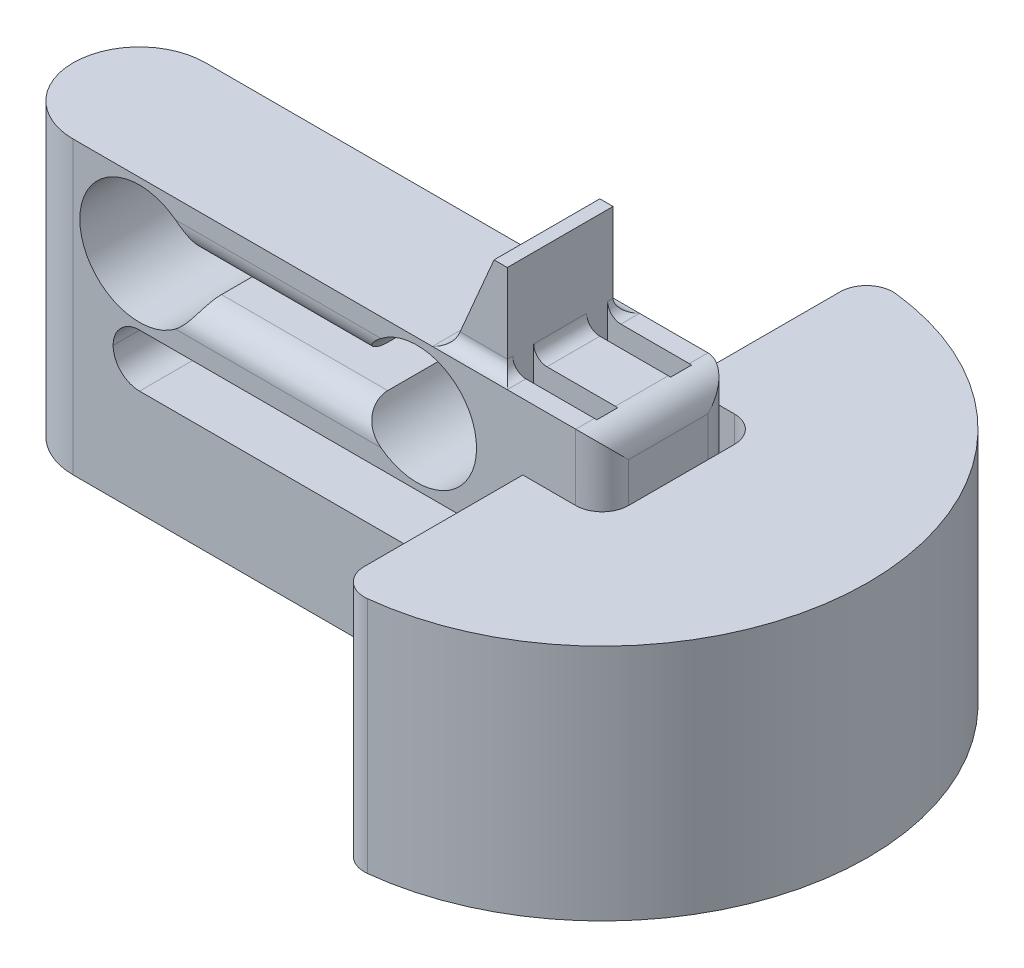
from build123d import *

# Parameters (mm, degrees)
BOSS_EXTRUDE1_DEPTH      = 5
BOSS_EXTRUDE1_DEPTH_BACK = 5
SKETCH2_W                = 6.35
SKETCH2_H                = 1.5875
CUT_EXTRUDE1_DEPTH       = 5
BOSS_EXTRUDE2_START      = -14
SKETCH3_W                = 5.881583951
SKETCH3_H                = 10
BOSS_EXTRUDE2_DEPTH      = 8
BOSS_EXTRUDE3_START      = 10
BOSS_EXTRUDE3_DEPTH      = 10
FILLET2_R                = 5
FILLET6_R                = 2
FILLET3_R                = 2
SKETCH5_R                = 1.5
SKETCH5_W                = 3
SKETCH5_H                = 3
CUT_EXTRUDE2_DEPTH       = 4
FILLET4_R                = 1
SKETCH6_R                = 3.25
CUT_EXTRUDE3_DEPTH       = 5
BOSS_EXTRUDE4_START      = -14
SKETCH7_R                = 2.5
BOSS_EXTRUDE4_DEPTH      = 3.7
SKETCH9_R                = 1.45
CUT_EXTRUDE4_DEPTH       = 4.6
FILLET5_R                = 2.5
SKETCH10_W               = 4
SKETCH10_H               = 8
BOSS_EXTRUDE5_DEPTH      = 7
CUT_EXTRUDE5_REACH       = 53.57
FILLET7_R                = 1


# Some blends are built 0.0001 mm under size
with BuildPart() as part:
    # Sketch1 → Boss-Extrude1 (new, two sides: drawn at the far end of the back side and taken through both)
    with BuildSketch(Plane.XY.offset(-BOSS_EXTRUDE1_DEPTH_BACK)):
        Polygon((5, -10), (5, 0), (0, 0), (-5, 0), (-35, 0), (-40, 0), (-40, -14), (-31.982625312, -14), (-31.982625312, -10), (-5, -10), align=None)
        with BuildLine():
            ThreePointArc((-25.78623506, -6.579298906), (-34.5, -5), (-25.78623506, -3.420701094))
            Line((-25.78623506, -3.420701094), (-13.21376494, -3.420701094))
            ThreePointArc((-13.21376494, -3.420701094), (-8.197485897, -0.572136959), (-4.5, -5))
            ThreePointArc((-4.5, -5), (-8.197485897, -9.427863041), (-13.21376494, -6.579298906))
            Line((-13.21376494, -6.579298906), (-25.78623506, -6.579298906))
        make_face(mode=Mode.SUBTRACT)
    extrude(amount=BOSS_EXTRUDE1_DEPTH + BOSS_EXTRUDE1_DEPTH_BACK)

    # Sketch2 → Cut-Extrude1 (cut)
    with BuildSketch(Plane(origin=(0, 0, 0), x_dir=(1, 0, 0), z_dir=(0, 1, 0))):
        with Locations((0, -2.79375)):
            Rectangle(SKETCH2_W, SKETCH2_H)
        with Locations((0, 2.79375)):
            Rectangle(SKETCH2_W, SKETCH2_H)
    extrude(amount=-CUT_EXTRUDE1_DEPTH, mode=Mode.SUBTRACT)

    # Sketch3 → Boss-Extrude2 (add)
    with BuildSketch(Plane(origin=(0, 0, 0), x_dir=(1, 0, 0), z_dir=(0, 1, 0)).offset(BOSS_EXTRUDE2_START)):
        with BuildLine():
            Line((0, 20.1), (0, 5))
            Line((0, 5), (5.881583951, 5))
            Line((5.881583951, 5), (5.881583951, -5))
            Line((5.881583951, -5), (0, -5))
            Line((0, -5), (0, -20.1))
            ThreePointArc((0, -20.1), (14.212846302, -14.212846302), (20.1, 0))
            ThreePointArc((20.1, 0), (14.212846302, 14.212846302), (0, 20.1))
        make_face()
        with Locations((2.940791976, 0)):
            Rectangle(SKETCH3_W, SKETCH3_H)
        with BuildLine():
            Line((0, 5), (-19.468179165, 5))
            ThreePointArc((-19.468179165, 5), (-20.1, 0), (-19.468179165, -5))
            Line((-19.468179165, -5), (0, -5))
            Line((0, -5), (0, 5))
        make_face()
        with BuildLine():
            Line((-19.468179165, 5), (-40, 5))
            Line((-40, 5), (-40, -5))
            Line((-40, -5), (-19.468179165, -5))
            ThreePointArc((-19.468179165, -5), (-20.1, 0), (-19.468179165, 5))
        make_face()
    extrude(amount=-BOSS_EXTRUDE2_DEPTH)

    # Sketch4 → Boss-Extrude3 (add)
    with BuildSketch(Plane(origin=(0, -14, 0), x_dir=(1, 0, 0), z_dir=(0, 1, 0)).offset(BOSS_EXTRUDE3_START)):
        with BuildLine():
            ThreePointArc((20.1, 0), (14.212846302, 14.212846302), (0, 20.1))
            Line((0, 20.1), (0, 6))
            Line((0, 6), (6, 6))
            Line((6, 6), (6, -6))
            Line((6, -6), (0, -6))
            Line((0, -6), (0, -20.1))
            ThreePointArc((0, -20.1), (14.212846302, -14.212846302), (20.1, 0))
        make_face()
    extrude(amount=-BOSS_EXTRUDE3_DEPTH)

    # Fillet2
    fillet2_edges = [part.edges().sort_by_distance(p)[0] for p in [
        (-40, -11, -5),
        (-40, -11, 5),
    ]]
    fillet(fillet2_edges, radius=FILLET2_R - 0.0001)  # a hair under: the kernel refuses the full size

    # Fillet6
    # the kernel refuses this fillet: 2 mm, written as the material it adds along each edge
    with BuildSketch(Plane(origin=(6, -4, -6), x_dir=(-1, 0, 0), z_dir=(0, -1, 0))) as fillet6_piece_1:
        with BuildLine():
            CenterArc((FILLET6_R, -FILLET6_R), FILLET6_R, 90, 90)
            Line((0, -FILLET6_R), (0, 0))
            Line((0, 0), (FILLET6_R, 0))
        make_face()
    extrude(amount=15)
    with BuildSketch(Plane(origin=(6, -4, 6), x_dir=(-1, 0, 0), z_dir=(0, -1, 0))) as fillet6_piece_2:
        with BuildLine():
            CenterArc((FILLET6_R, FILLET6_R), FILLET6_R, 180, 90)
            Line((0, FILLET6_R), (0, 0))
            Line((0, 0), (FILLET6_R, 0))
        make_face()
    extrude(amount=15)
    # the kernel refuses this fillet: 2 mm, written as the material it takes off along each edge
    with BuildSketch(Plane(origin=(5, -15, -5), x_dir=(0, 0, 1), z_dir=(0, 1, 0))) as fillet6_2_piece_1_section:
        with BuildLine():
            CenterArc((FILLET6_R, -FILLET6_R), FILLET6_R, 90, 90)
            Line((0, -FILLET6_R), (0, 0))
            Line((0, 0), (FILLET6_R, 0))
        make_face()
    fillet6_2_piece_1 = extrude(amount=20, mode=Mode.PRIVATE)
    fillet6_2_piece_1 = split(fillet6_2_piece_1, bisect_by=Plane(origin=(4.553264122, -14, -4.553264122), z_dir=(0, 1, 0)), keep=Keep.TOP, mode=Mode.PRIVATE)
    add(fillet6_2_piece_1, mode=Mode.SUBTRACT)
    with BuildSketch(Plane(origin=(5, -15, 5), x_dir=(-1, 0, 0), z_dir=(0, 1, 0))) as fillet6_2_piece_2_section:
        with BuildLine():
            CenterArc((FILLET6_R, -FILLET6_R), FILLET6_R, 90, 90)
            Line((0, -FILLET6_R), (0, 0))
            Line((0, 0), (FILLET6_R, 0))
        make_face()
    fillet6_2_piece_2 = extrude(amount=20, mode=Mode.PRIVATE)
    fillet6_2_piece_2 = split(fillet6_2_piece_2, bisect_by=Plane(origin=(4.553264122, -14, 4.553264122), z_dir=(0, 1, 0)), keep=Keep.TOP, mode=Mode.PRIVATE)
    add(fillet6_2_piece_2, mode=Mode.SUBTRACT)
    with BuildSketch(Plane(origin=(5, 0, -10), x_dir=(-1, 0, 0), z_dir=(0, 0, 1))) as fillet6_2_piece_3:
        with BuildLine():
            CenterArc((FILLET6_R, FILLET6_R), FILLET6_R, 180, 90)
            Line((0, FILLET6_R), (0, 0))
            Line((0, 0), (FILLET6_R, 0))
        make_face()
    extrude(amount=20, mode=Mode.SUBTRACT)

    # Fillet3
    fillet3_edges = [part.edges().sort_by_distance(p)[0] for p in [
        (-19.5, -3.420701094, -5),
        (-19.5, -6.579298906, -5),
        (-19.5, -6.579298906, 5),
        (-19.5, -3.420701094, 5),
        (-31.982625312, -10, 0),
        (-31.982625312, -14, 0),
        (0, -13, -20.1),
        (0, -13, 20.1),
    ]]
    fillet(fillet3_edges, radius=FILLET3_R - 0.0001)  # a hair under: the kernel refuses the full size

    # Sketch5 → Cut-Extrude2 (cut)
    with BuildSketch(Plane.XZ.offset(22)):
        with Locations(Location((0, 0, 0), (0, 0, 270))):
            Circle(SKETCH5_R)
        with BuildLine():
            Line((-35, 3.25), (-12, 3.25))
            ThreePointArc((-12, 3.25), (-8.75, 0), (-12, -3.25))
            Line((-12, -3.25), (-35, -3.25))
            ThreePointArc((-35, -3.25), (-38.25, 0), (-35, 3.25))
        make_face()
        with Locations((-6, 0)):
            Rectangle(SKETCH5_W, SKETCH5_H)
        with Locations((6, 0)):
            Rectangle(SKETCH5_W, SKETCH5_H)
    extrude(amount=-CUT_EXTRUDE2_DEPTH, mode=Mode.SUBTRACT)

    # Fillet4
    fillet4_edges = [part.edges().sort_by_distance(p)[0] for p in [
        (-23.5, -18, 3.25),
        (-8.75, -18, 0),
        (-23.5, -18, -3.25),
        (-38.25, -18, 0),
        (0, -18, -5),
        (0, -18, 5),
    ]]
    fillet(fillet4_edges, radius=FILLET4_R)

    # Sketch6 → Cut-Extrude3 (cut)
    with BuildSketch(Plane.XZ.offset(22)):
        with Locations(Location((-35, 0, 0), (0, 0, 270))):
            Circle(SKETCH6_R)
    extrude(amount=-CUT_EXTRUDE3_DEPTH, mode=Mode.SUBTRACT)

    # Sketch7 → Boss-Extrude4 (add)
    with BuildSketch(Plane(origin=(0, 0, 0), x_dir=(1, 0, 0), z_dir=(0, 1, 0)).offset(BOSS_EXTRUDE4_START)):
        with Locations(Location((0, 0, 0), (0, 0, 270))):
            Circle(SKETCH7_R)
    extrude(amount=BOSS_EXTRUDE4_DEPTH)

    # Sketch9 → Cut-Extrude4 (cut)
    with BuildSketch(Plane(origin=(0, -10.3, 0), x_dir=(1, 0, 0), z_dir=(0, 1, 0))):
        with Locations(Location((0, 0, 0), (0, 0, 270))):
            Circle(SKETCH9_R)
    extrude(amount=-CUT_EXTRUDE4_DEPTH, mode=Mode.SUBTRACT)

    # Fillet5
    fillet5_edges = [part.edges().sort_by_distance(p)[0] for p in [
        (0, -14, -2.5),
    ]]
    fillet(fillet5_edges, radius=FILLET5_R)

    # Sketch10 → Boss-Extrude5 (add)
    with BuildSketch(Plane(origin=(0, 0, 0), x_dir=(1, 0, 0), z_dir=(0, 1, 0))):
        with Locations((-5.175, 0)):
            Rectangle(SKETCH10_W, SKETCH10_H)
    extrude(amount=BOSS_EXTRUDE5_DEPTH)

    # Sketch11 → Cut-Extrude5 (cut, up to next)
    with BuildSketch(Plane.XY.offset(4), mode=Mode.PRIVATE) as cut_extrude5_sk1:
        Polygon((-7.175, 0), (-7.175, 7), (-4.175, 7), align=None)
    cut_extrude5_tool1 = extrude(cut_extrude5_sk1.sketch, amount=-CUT_EXTRUDE5_REACH, mode=Mode.PRIVATE) & part.part
    add(cut_extrude5_tool1.solids().sort_by_distance((-6.175, 4.666667, 4))[0], mode=Mode.SUBTRACT)

    # Fillet7
    # the kernel refuses this fillet: 1 mm, written as the material it adds along each edge
    with BuildSketch(Plane(origin=(-3.175, 0, 4), x_dir=(1, 0, 0), z_dir=(0, 0, -1)), Plane(origin=(-3.175, 0, -3.5875), x_dir=(1, 0, 0), z_dir=(0, 0, -1))) as fillet7_piece_1:
        with BuildLine():
            CenterArc((FILLET7_R, -FILLET7_R), FILLET7_R, 90, 90)
            Line((0, -FILLET7_R), (0, 0))
            Line((0, 0), (FILLET7_R, 0))
        make_face()
    extrude(amount=0.4125)
    with BuildSketch(Plane(origin=(-3.175, 0, 4), x_dir=(1, 0, 0), z_dir=(0, 0, -1))) as fillet7_piece_2_section:
        with BuildLine():
            CenterArc((FILLET7_R, -FILLET7_R), FILLET7_R, 90, 90)
            Line((0, -FILLET7_R), (0, 0))
            Line((0, 0), (FILLET7_R, 0))
        make_face()
    fillet7_piece_2 = extrude(amount=2.9125, mode=Mode.PRIVATE)
    fillet7_piece_2 = split(fillet7_piece_2, bisect_by=Plane(origin=(-2.948604886, 0.226395114, 2), z_dir=(0, 0, -1)), keep=Keep.TOP, mode=Mode.PRIVATE)
    add(fillet7_piece_2)
    with BuildSketch(Plane(origin=(-3.175, 0, 4.5), x_dir=(0, 1, 0), z_dir=(0, 0, -1))) as fillet7_piece_3_section:
        with BuildLine():
            CenterArc((FILLET7_R, FILLET7_R), FILLET7_R, 180, 90)
            Line((0, FILLET7_R), (0, 0))
            Line((0, 0), (FILLET7_R, 0))
        make_face()
    fillet7_piece_3 = extrude(amount=6.5, mode=Mode.PRIVATE)
    fillet7_piece_3 = split(fillet7_piece_3, bisect_by=Plane(origin=(-2.948604886, 0.226395114, 3.5875), z_dir=(0, 0, 1)), keep=Keep.TOP, mode=Mode.PRIVATE)
    fillet7_piece_3 = split(fillet7_piece_3, bisect_by=Plane(origin=(-2.948604886, 0.226395114, 4), z_dir=(0, 0, -1)), keep=Keep.TOP, mode=Mode.PRIVATE)
    add(fillet7_piece_3)
    with BuildSketch(Plane(origin=(-3.175, 0, 2), x_dir=(0, 1, 0), z_dir=(0, 0, -1))) as fillet7_piece_4:
        with BuildLine():
            CenterArc((FILLET7_R, FILLET7_R), FILLET7_R, 180, 90)
            Line((0, FILLET7_R), (0, 0))
            Line((0, 0), (FILLET7_R, 0))
        make_face()
    extrude(amount=4)
    with BuildSketch(Plane(origin=(-3.175, 0, 2), x_dir=(0, 1, 0), z_dir=(0, 0, -1))) as fillet7_piece_5_section:
        with BuildLine():
            CenterArc((FILLET7_R, FILLET7_R), FILLET7_R, 180, 90)
            Line((0, FILLET7_R), (0, 0))
            Line((0, 0), (FILLET7_R, 0))
        make_face()
    fillet7_piece_5 = extrude(amount=6.5, mode=Mode.PRIVATE)
    fillet7_piece_5 = split(fillet7_piece_5, bisect_by=Plane(origin=(-2.948604886, 0.226395114, -3.5875), z_dir=(0, 0, -1)), keep=Keep.TOP, mode=Mode.PRIVATE)
    fillet7_piece_5 = split(fillet7_piece_5, bisect_by=Plane(origin=(-2.948604886, 0.226395114, -4), z_dir=(0, 0, 1)), keep=Keep.TOP, mode=Mode.PRIVATE)
    add(fillet7_piece_5)
    with BuildSketch(Plane(origin=(-3.175, 0, -1.0875), x_dir=(1, 0, 0), z_dir=(0, 0, -1))) as fillet7_piece_6_section:
        with BuildLine():
            CenterArc((FILLET7_R, -FILLET7_R), FILLET7_R, 90, 90)
            Line((0, -FILLET7_R), (0, 0))
            Line((0, 0), (FILLET7_R, 0))
        make_face()
    fillet7_piece_6 = extrude(amount=2.9125, mode=Mode.PRIVATE)
    fillet7_piece_6 = split(fillet7_piece_6, bisect_by=Plane(origin=(-2.948604886, 0.226395114, -2), z_dir=(0, 0, 1)), keep=Keep.TOP, mode=Mode.PRIVATE)
    add(fillet7_piece_6)
    with BuildSketch(Plane(origin=(-3.175, 0, -4), x_dir=(0, 0, -1), z_dir=(-1, 0, 0))) as fillet7_piece_7_section:
        with BuildLine():
            CenterArc((FILLET7_R, -FILLET7_R), FILLET7_R, 90, 90)
            Line((0, -FILLET7_R), (0, 0))
            Line((0, 0), (FILLET7_R, 0))
        make_face()
    fillet7_piece_7 = extrude(amount=6.5, mode=Mode.PRIVATE)
    fillet7_piece_7 = split(fillet7_piece_7, bisect_by=Plane(origin=(-6.777174101, 0.928260431, -4.229410037), z_dir=(0.9191450300180579, -0.3939192985791677, 0)), keep=Keep.TOP, mode=Mode.PRIVATE)
    add(fillet7_piece_7)
    with BuildSketch(Plane(origin=(-7.175, 0, -4), x_dir=(-1, 0, 0), z_dir=(0, 0, 1))) as fillet7_piece_8:
        with BuildLine():
            CenterArc((FILLET7_R * 0.659396157981, -FILLET7_R), FILLET7_R, 90, 66.801409486)
            Line((-FILLET7_R * 0.259748872037, -FILLET7_R * 0.606080701421), (0, 0))
            Line((0, 0), (FILLET7_R * 0.659396157981, 0))
        make_face()
    extrude(amount=8)
    with BuildSketch(Plane(origin=(-9.675, 0, 4), x_dir=(0, 0, 1), z_dir=(1, 0, 0))) as fillet7_piece_9_section:
        with BuildLine():
            CenterArc((FILLET7_R, -FILLET7_R), FILLET7_R, 90, 90)
            Line((0, -FILLET7_R), (0, 0))
            Line((0, 0), (FILLET7_R, 0))
        make_face()
    fillet7_piece_9 = extrude(amount=6.5, mode=Mode.PRIVATE)
    fillet7_piece_9 = split(fillet7_piece_9, bisect_by=Plane(origin=(-6.777174101, 0.928260431, 4.229410037), z_dir=(0.9191450300180579, -0.3939192985791677, 0)), keep=Keep.TOP, mode=Mode.PRIVATE)
    add(fillet7_piece_9)
    with BuildSketch(Plane(origin=(-3.175, 0, 6.5), x_dir=(1, 0, 0), z_dir=(0, 0, -1))) as fillet7_piece_10a_section:
        with BuildLine():
            CenterArc((FILLET7_R, -FILLET7_R), FILLET7_R, 90, 90)
            Line((0, -FILLET7_R), (0, 0))
            Line((0, 0), (FILLET7_R, 0))
        make_face()
    fillet7_piece_10a = extrude(amount=2.9125, mode=Mode.PRIVATE)
    fillet7_piece_10a = split(fillet7_piece_10a, bisect_by=Plane(origin=(-2.948604886, 0.226395114, 5), z_dir=(0, 0, -1)), keep=Keep.TOP, mode=Mode.PRIVATE)
    fillet7_piece_10a = split(fillet7_piece_10a, bisect_by=Plane(origin=(-2.948604886, 0.226395114, 4), z_dir=(0, 0, 1)), keep=Keep.TOP, mode=Mode.PRIVATE)
    with BuildSketch(Plane(origin=(-9.675, 0, 4), x_dir=(0, 0, 1), z_dir=(1, 0, 0))) as fillet7_piece_10b_section:
        with BuildLine():
            CenterArc((FILLET7_R, -FILLET7_R), FILLET7_R, 90, 90)
            Line((0, -FILLET7_R), (0, 0))
            Line((0, 0), (FILLET7_R, 0))
        make_face()
    fillet7_piece_10b = extrude(amount=9, mode=Mode.PRIVATE)
    fillet7_piece_10b = split(fillet7_piece_10b, bisect_by=Plane(origin=(-3.175, 0.226395114, 4.226395114), z_dir=(1, 0, 0)), keep=Keep.TOP, mode=Mode.PRIVATE)
    fillet7_piece_10 = fillet7_piece_10a & fillet7_piece_10b
    add(fillet7_piece_10)
    with BuildSketch(Plane(origin=(-0.675, 0, -4), x_dir=(0, 0, -1), z_dir=(-1, 0, 0))) as fillet7_piece_11a_section:
        with BuildLine():
            CenterArc((FILLET7_R, -FILLET7_R), FILLET7_R, 90, 90)
            Line((0, -FILLET7_R), (0, 0))
            Line((0, 0), (FILLET7_R, 0))
        make_face()
    fillet7_piece_11a = extrude(amount=9, mode=Mode.PRIVATE)
    fillet7_piece_11a = split(fillet7_piece_11a, bisect_by=Plane(origin=(-3.175, 0.226395114, -4.226395114), z_dir=(1, 0, 0)), keep=Keep.TOP, mode=Mode.PRIVATE)
    with BuildSketch(Plane(origin=(-3.175, 0, -3.5875), x_dir=(1, 0, 0), z_dir=(0, 0, -1))) as fillet7_piece_11b_section:
        with BuildLine():
            CenterArc((FILLET7_R, -FILLET7_R), FILLET7_R, 90, 90)
            Line((0, -FILLET7_R), (0, 0))
            Line((0, 0), (FILLET7_R, 0))
        make_face()
    fillet7_piece_11b = extrude(amount=2.9125, mode=Mode.PRIVATE)
    fillet7_piece_11b = split(fillet7_piece_11b, bisect_by=Plane(origin=(-2.948604886, 0.226395114, -5), z_dir=(0, 0, 1)), keep=Keep.TOP, mode=Mode.PRIVATE)
    fillet7_piece_11b = split(fillet7_piece_11b, bisect_by=Plane(origin=(-2.948604886, 0.226395114, -4), z_dir=(0, 0, -1)), keep=Keep.TOP, mode=Mode.PRIVATE)
    fillet7_piece_11 = fillet7_piece_11a & fillet7_piece_11b
    add(fillet7_piece_11)
    with BuildSketch(Plane(origin=(-7.175, 0, -5.648490395), x_dir=(-1, 0, 0), z_dir=(0, 0, 1))) as fillet7_piece_12a_section:
        with BuildLine():
            CenterArc((FILLET7_R * 0.659396157981, -FILLET7_R), FILLET7_R, 90, 66.801409486)
            Line((-FILLET7_R * 0.259748872037, -FILLET7_R * 0.606080701421), (0, 0))
            Line((0, 0), (FILLET7_R * 0.659396157981, 0))
        make_face()
    fillet7_piece_12a = extrude(amount=9.648490395, mode=Mode.PRIVATE)
    fillet7_piece_12a = split(fillet7_piece_12a, bisect_by=Plane(origin=(-7.262287498, 0.132374897, -5), z_dir=(0, 0, 1)), keep=Keep.TOP, mode=Mode.PRIVATE)
    fillet7_piece_12a = split(fillet7_piece_12a, bisect_by=Plane(origin=(-7.262287498, 0.132374897, -4), z_dir=(0, 0, -1)), keep=Keep.TOP, mode=Mode.PRIVATE)
    with BuildSketch(Plane(origin=(-3.175, 0, -4), x_dir=(0, 0, -1), z_dir=(-1, 0, 0))) as fillet7_piece_12b_section:
        with BuildLine():
            CenterArc((FILLET7_R, -FILLET7_R), FILLET7_R, 90, 90)
            Line((0, -FILLET7_R), (0, 0))
            Line((0, 0), (FILLET7_R, 0))
        make_face()
    fillet7_piece_12b = extrude(amount=6.5, mode=Mode.PRIVATE)
    fillet7_piece_12b = split(fillet7_piece_12b, bisect_by=Plane(origin=(-7.276434947, -0.236681543, -4.221864101), z_dir=(-0.9191450300180579, 0.3939192985791677, 0)), keep=Keep.TOP, mode=Mode.PRIVATE)
    fillet7_piece_12 = fillet7_piece_12a & fillet7_piece_12b
    add(fillet7_piece_12)
    with BuildSketch(Plane(origin=(-9.675, 0, 4), x_dir=(0, 0, 1), z_dir=(1, 0, 0))) as fillet7_piece_13a_section:
        with BuildLine():
            CenterArc((FILLET7_R, -FILLET7_R), FILLET7_R, 90, 90)
            Line((0, -FILLET7_R), (0, 0))
            Line((0, 0), (FILLET7_R, 0))
        make_face()
    fillet7_piece_13a = extrude(amount=6.5, mode=Mode.PRIVATE)
    fillet7_piece_13a = split(fillet7_piece_13a, bisect_by=Plane(origin=(-7.276434947, -0.236681543, 4.221864101), z_dir=(-0.9191450300180579, 0.3939192985791677, 0)), keep=Keep.TOP, mode=Mode.PRIVATE)
    with BuildSketch(Plane(origin=(-7.175, 0, -4), x_dir=(-1, 0, 0), z_dir=(0, 0, 1))) as fillet7_piece_13b_section:
        with BuildLine():
            CenterArc((FILLET7_R * 0.659396157981, -FILLET7_R), FILLET7_R, 90, 66.801409486)
            Line((-FILLET7_R * 0.259748872037, -FILLET7_R * 0.606080701421), (0, 0))
            Line((0, 0), (FILLET7_R * 0.659396157981, 0))
        make_face()
    fillet7_piece_13b = extrude(amount=9.648490395, mode=Mode.PRIVATE)
    fillet7_piece_13b = split(fillet7_piece_13b, bisect_by=Plane(origin=(-7.262287498, 0.132374897, 5), z_dir=(0, 0, -1)), keep=Keep.TOP, mode=Mode.PRIVATE)
    fillet7_piece_13b = split(fillet7_piece_13b, bisect_by=Plane(origin=(-7.262287498, 0.132374897, 4), z_dir=(0, 0, 1)), keep=Keep.TOP, mode=Mode.PRIVATE)
    fillet7_piece_13 = fillet7_piece_13a & fillet7_piece_13b
    add(fillet7_piece_13)


solid = part.part
